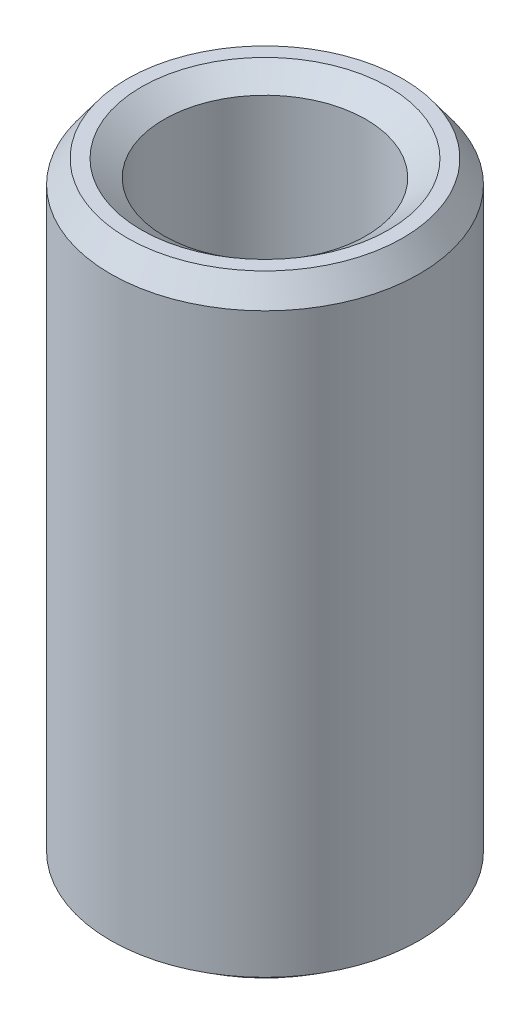
from build123d import *
from OCP.BRepFilletAPI import BRepFilletAPI_MakeChamfer

# Parameters (mm, degrees)
SKETCH1_R           = 7.5
BOSS_EXTRUDE1_DEPTH = 29.938073754
SKETCH2_R           = 4.902236572
CUT_EXTRUDE1_DEPTH  = 32.761427237
CHAMFER1_SIZE       = 1.105538217
CHAMFER1_SIZE2      = 0.808139165


with BuildPart() as part:
    # Sketch1 → Boss-Extrude1 (new body)
    with BuildSketch(Plane(origin=(0, 0, 0), x_dir=(1, 0, 0), z_dir=(0, 1, 0))):
        Circle(SKETCH1_R)
    extrude(amount=BOSS_EXTRUDE1_DEPTH)

    # Sketch2 → Cut-Extrude1 (cut, through all)
    with BuildSketch(Plane(origin=(0, 0, 0), x_dir=(1, 0, 0), z_dir=(0, 1, 0))):
        Circle(SKETCH2_R)
    extrude(amount=CUT_EXTRUDE1_DEPTH, mode=Mode.SUBTRACT)

    # Chamfer1: one chamfer whose edges measure the first distance from different faces: ONE call of the kernel's chamfer builder (chamfer() names one face for all edges)
    chamfer1_edges_1 = [part.edges().sort_by_distance(p)[0] for p in [
        (-4.902236572, 29.938073754, 0),
    ]]
    chamfer1_side_1 = [part.faces().sort_by_distance(p)[0] for p in [
        (-7.287867966, 29.938073754, 0),
    ]]
    chamfer1_edges_2 = [part.edges().sort_by_distance(p)[0] for p in [
        (-4.902236572, 0, 0),
    ]]
    chamfer1_side_2 = [part.faces().sort_by_distance(p)[0] for p in [
        (-4.902236572, 14.969036877, 0),
    ]]
    chamfer1_edges_3 = [part.edges().sort_by_distance(p)[0] for p in [
        (-7.5, 0, 0),
    ]]
    chamfer1_side_3 = [part.faces().sort_by_distance(p)[0] for p in [
        (-7.287867966, 0, 0),
    ]]
    chamfer1_edges_4 = [part.edges().sort_by_distance(p)[0] for p in [
        (-7.5, 29.938073754, 0),
    ]]
    chamfer1_side_4 = [part.faces().sort_by_distance(p)[0] for p in [
        (-7.5, 14.969036877, 0),
    ]]
    chamfer1 = BRepFilletAPI_MakeChamfer(part.part.solid().wrapped)
    for e in chamfer1_edges_1:
        chamfer1.Add(CHAMFER1_SIZE, CHAMFER1_SIZE2, e.wrapped, chamfer1_side_1[0].wrapped)  # the first distance lies on this face
    for e in chamfer1_edges_2:
        chamfer1.Add(CHAMFER1_SIZE, CHAMFER1_SIZE2, e.wrapped, chamfer1_side_2[0].wrapped)  # the first distance lies on this face
    for e in chamfer1_edges_3:
        chamfer1.Add(CHAMFER1_SIZE, CHAMFER1_SIZE2, e.wrapped, chamfer1_side_3[0].wrapped)  # the first distance lies on this face
    for e in chamfer1_edges_4:
        chamfer1.Add(CHAMFER1_SIZE, CHAMFER1_SIZE2, e.wrapped, chamfer1_side_4[0].wrapped)  # the first distance lies on this face
    add(Compound.cast(chamfer1.Shape()), mode=Mode.REPLACE)


solid = part.part
